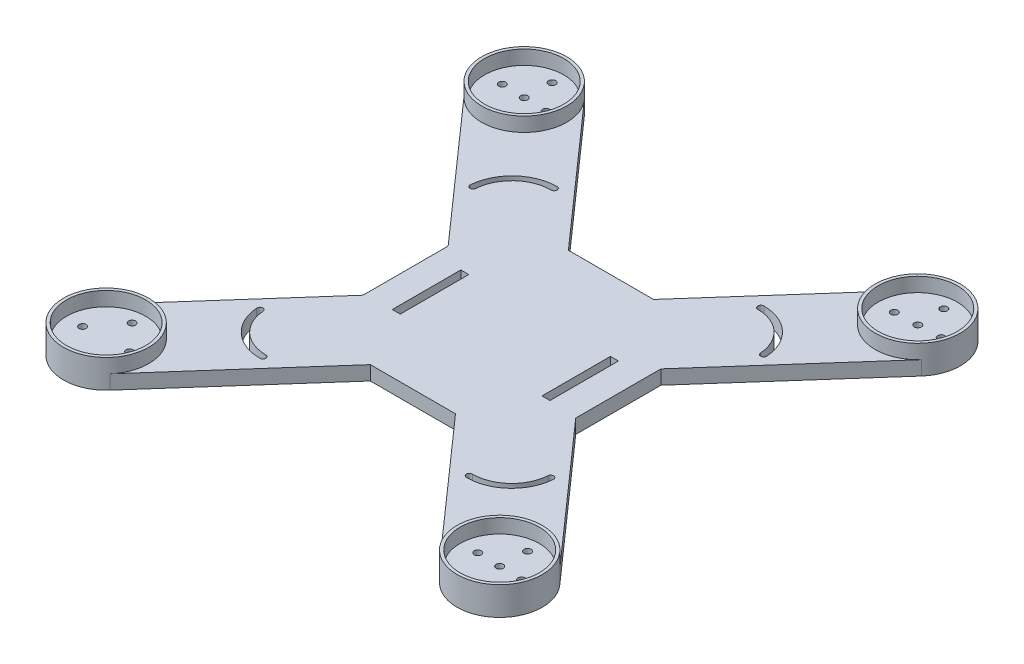
from build123d import *
from build123d.topology import SkipClean

# Parameters (mm, degrees)
BOSS_EXTRUDE1_DEPTH    = 5
M3_TAPPED_HOLE1_D      = 2.5
SKETCH2_R              = 13.95
BOSS_EXTRUDE4_DEPTH    = 5
CUT_EXTRUDE1_START     = -5
CUT_EXTRUDE1_OUTLINE_W = 2.807246308
CUT_EXTRUDE1_OUTLINE_H = 24.121523831
CUT_EXTRUDE1_DEPTH     = 5


# Read off the part's stored shape, not the designer's step: Cut-Extrude1
with BuildPart() as part:
    # Sketch1 → Boss-Extrude1 (new body)
    with BuildSketch(Plane(origin=(0, 0, 0), x_dir=(1, 0, 0), z_dir=(0, 1, 0))):
        with BuildLine():
            Line((-15, 7.390657387), (15, 7.390657387))
            Line((15, 7.390657387), (58.070303134, 56.072779239))
            ThreePointArc((58.070303134, 56.072779239), (79.243939669, 57.367814327), (80.538974758, 36.194177792))
            Line((80.538974758, 36.194177792), (37.468671624, -12.487944059))
            Line((37.468671624, -12.487944059), (37.468671624, -42.487944059))
            Line((37.468671624, -42.487944059), (80.538974758, -91.17006591))
            ThreePointArc((80.538974758, -91.17006591), (79.243939669, -112.343702445), (58.070303134, -111.048667357))
            Line((58.070303134, -111.048667357), (15, -62.366545506))
            Line((15, -62.366545506), (-15, -62.366545506))
            Line((-15, -62.366545506), (-58.070303134, -111.048667357))
            ThreePointArc((-58.070303134, -111.048667357), (-79.243939669, -112.343702445), (-80.538974758, -91.17006591))
            Line((-80.538974758, -91.17006591), (-37.468671624, -42.487944059))
            Line((-37.468671624, -42.487944059), (-37.468671624, -12.487944059))
            Line((-37.468671624, -12.487944059), (-80.538974758, 36.194177792))
            ThreePointArc((-80.538974758, 36.194177792), (-79.243939669, 57.367814327), (-58.070303134, 56.072779239))
            Line((-58.070303134, 56.072779239), (-15, 7.390657387))
        make_face()
    extrude(amount=BOSS_EXTRUDE1_DEPTH)

    # M3 Tapped Hole1 (through all)
    with Locations(Plane(origin=(-77.299965137, 5, -46.406899623), x_dir=(0, 0, 1), z_dir=(0, 1, 0))):
        with Locations((0, 0), (0.273421108, 7.995326191), (-9.221028744, 8.320013756), (0.546842215, 15.990652382), (9.767870959, 7.670638626), (138.021816405, 7.670638626), (147.789687364, 0), (157.010716108, 8.320013756), (147.242845149, 15.990652382), (138.021816405, 146.929291648), (147.242845149, 138.609277892), (147.516266257, 146.604604083), (157.010716108, 146.279916518), (147.789687364, 154.599930274), (0.546842215, 138.609277892), (0.273421108, 146.604604083), (-9.221028744, 146.279916518), (9.767870959, 146.929291648), (0, 154.599930274)):
            Hole(M3_TAPPED_HOLE1_D / 2)

    # Sketch2 → Boss-Extrude4 (add)
    # profile 1 of 4: a face of its own
    with BuildSketch(Plane(origin=(0, 5, 0), x_dir=(1, 0, 0), z_dir=(0, 1, 0))):
        with BuildLine():
            ThreePointArc((-58.070303134, 56.072779239), (-59.365338223, 34.899142704), (-80.538974758, 36.194177792))
            ThreePointArc((-80.538974758, 36.194177792), (-79.243939669, 57.367814327), (-58.070303134, 56.072779239))
        make_face()
        with Locations(Location((-69.304638946, 46.133478515, 0), (0, 0, 270))):
            Circle(SKETCH2_R, mode=Mode.SUBTRACT)
    # profile 2 of 4: a face of its own
    with BuildSketch(Plane(origin=(0, 5, 0), x_dir=(1, 0, 0), z_dir=(0, 1, 0))):
        with BuildLine():
            ThreePointArc((-58.070303134, -111.048667357), (-59.365338223, -89.875030822), (-80.538974758, -91.17006591))
            ThreePointArc((-80.538974758, -91.17006591), (-79.243939669, -112.343702445), (-58.070303134, -111.048667357))
        make_face()
        with Locations(Location((-69.304638946, -101.109366634, 0), (0, 0, 270))):
            Circle(SKETCH2_R, mode=Mode.SUBTRACT)
    # profile 3 of 4: a face of its own
    with BuildSketch(Plane(origin=(0, 5, 0), x_dir=(1, 0, 0), z_dir=(0, 1, 0))):
        with BuildLine():
            ThreePointArc((58.070303134, -111.048667357), (59.365338223, -89.875030822), (80.538974758, -91.17006591))
            ThreePointArc((80.538974758, -91.17006591), (79.243939669, -112.343702445), (58.070303134, -111.048667357))
        make_face()
        with Locations(Location((69.304638946, -101.109366634, 0), (0, 0, 270))):
            Circle(SKETCH2_R, mode=Mode.SUBTRACT)
    # profile 4 of 4: a face of its own
    with BuildSketch(Plane(origin=(0, 5, 0), x_dir=(1, 0, 0), z_dir=(0, 1, 0))):
        with BuildLine():
            ThreePointArc((58.070303134, 56.072779239), (59.365338223, 34.899142704), (80.538974758, 36.194177792))
            ThreePointArc((80.538974758, 36.194177792), (79.243939669, 57.367814327), (58.070303134, 56.072779239))
        make_face()
        with Locations(Location((69.304638946, 46.133478515, 0), (0, 0, 270))):
            Circle(SKETCH2_R, mode=Mode.SUBTRACT)
    extrude(amount=BOSS_EXTRUDE4_DEPTH)

    # Cut-Extrude1 outline → Cut-Extrude1 (cut)
    with SkipClean():  # the faces are left unmerged after this step: merging them gives an invalid solid
        with BuildSketch(Plane(origin=(0, 5, 0), x_dir=(1, 0, 0), z_dir=(0, 1, 0)).offset(CUT_EXTRUDE1_START)):
            with BuildLine():
                ThreePointArc((-50.155470131, 9.911625133), (-45.783130536, 19.029963413), (-36.371791915, 22.729713658))
                ThreePointArc((-36.371791915, 22.729713658), (-35.321791915, 23.779713658), (-36.371791915, 24.829713658))
                ThreePointArc((-36.371791915, 24.829713658), (-47.213213279, 20.567774633), (-52.249943738, 10.063875941))
                ThreePointArc((-52.249943738, 10.063875941), (-51.278832338, 8.940513734), (-50.155470131, 9.911625133))
            make_face()
            with Locations((26.180408459, -29.623395638)):
                Rectangle(CUT_EXTRUDE1_OUTLINE_W, CUT_EXTRUDE1_OUTLINE_H)
            with Locations((-26.533438878, -29.623395638)):
                Rectangle(CUT_EXTRUDE1_OUTLINE_W, CUT_EXTRUDE1_OUTLINE_H)
            with BuildLine():
                ThreePointArc((52.249943738, 10.063875941), (47.213213279, 20.567774633), (36.371791915, 24.829713658))
                ThreePointArc((36.371791915, 24.829713658), (35.321791915, 23.779713658), (36.371791915, 22.729713658))
                ThreePointArc((36.371791915, 22.729713658), (45.783130536, 19.029963413), (50.155470131, 9.911625133))
                ThreePointArc((50.155470131, 9.911625133), (51.278832338, 8.940513734), (52.249943738, 10.063875941))
            make_face()
            with BuildLine():
                ThreePointArc((50.155470131, -64.964128793), (45.783130536, -74.082467073), (36.371791915, -77.782217317))
                ThreePointArc((36.371791915, -77.782217317), (35.321791915, -78.832217317), (36.371791915, -79.882217317))
                ThreePointArc((36.371791915, -79.882217317), (47.213213279, -75.620278293), (52.249943738, -65.116379601))
                ThreePointArc((52.249943738, -65.116379601), (51.278832338, -63.993017394), (50.155470131, -64.964128793))
            make_face()
            with BuildLine():
                ThreePointArc((-52.249943738, -65.116379601), (-47.213213279, -75.620278293), (-36.371791915, -79.882217317))
                ThreePointArc((-36.371791915, -79.882217317), (-35.321791915, -78.832217317), (-36.371791915, -77.782217317))
                ThreePointArc((-36.371791915, -77.782217317), (-45.783130536, -74.082467073), (-50.155470131, -64.964128793))
                ThreePointArc((-50.155470131, -64.964128793), (-51.278832338, -63.993017394), (-52.249943738, -65.116379601))
            make_face()
        extrude(amount=CUT_EXTRUDE1_DEPTH, mode=Mode.SUBTRACT)


solid = part.part
